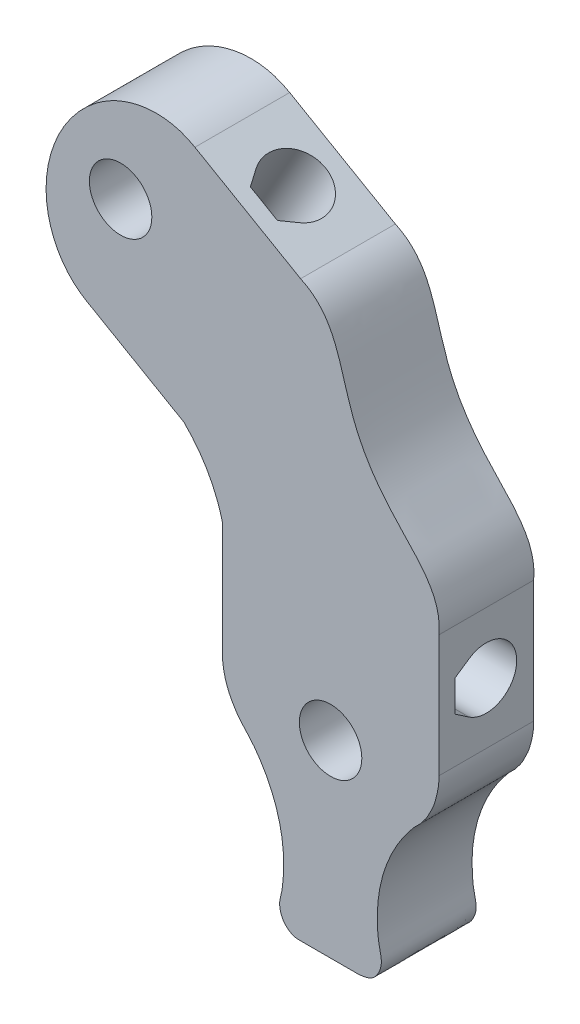
from build123d import *

# Parameters (mm, degrees)
MODEL_R               = 4.350000706
MODEL_R_2             = 4.349999799
MAIN_BODY_DEPTH       = 13.2
SIDE_UP_GRAPHIC_DEPTH = 1
HOLE_1_REACH          = 105.138
HOLE_2_REACH          = 92.65
FEET_START            = -13.2
FEET_DEPTH            = 13.2
FEET_2_DEPTH          = 13.2


with BuildPart() as part:
    # Model → Main body (new body)
    with BuildSketch(Plane.XY):
        with BuildLine():
            Line((-32.385278451, 85.015032789), (-17.6641047, 76.515992185))
            add(Edge.make_bspline(
                [(-17.6641047, 76.515992185), (-13.888722486, 74.796310284), (-12.180872386, 69.346040832), (-10.138677855, 62.322648799), (-7.341971962, 57.370319929), (-2.311165044, 51.709551581), (2.051636145, 47.586423037), (1.587639106, 43.172213575)],
                knots=[0, 0, 0, 0, 0.279425433, 0.41981198, 0.560237256, 0.707310001, 1, 1, 1, 1], degree=3))
            Line((1.587639106, 43.172213575), (1.587638631, 26.172213575))
            add(Edge.make_bspline(
                [(1.587638631, 26.172213575), (1.626935513, 22.433749487), (-1.504300665, 17.452795295), (-8.065829548, 14.211603151), (-13.487361838, 13.402379484), (-18.908893689, 14.211603727), (-25.470424367, 17.452793212), (-28.601657646, 22.43375075), (-28.56236242, 26.172213575)],
                knots=[0, 0, 0, 0, 0.249525848, 0.374711548, 0.499999996, 0.625288445, 0.750474147, 1, 1, 1, 1], degree=3))
            Line((-28.56236242, 26.172213575), (-28.56236242, 41.723666211))
            add(Edge.make_bspline(
                [(-33.914159524, 51.083510419), (-29.942183369, 47.173551609), (-28.56236242, 41.723666211)],
                knots=[0, 0, 0, 1, 1, 1], degree=2))
            Line((-33.914159524, 51.083510419), (-47.460258007, 58.904368421))
            add(Edge.make_bspline(
                [(-32.385278451, 85.015032789), (-35.600190369, 86.916553219), (-41.474036655, 86.698356276), (-47.559386008, 82.644557032), (-50.972092804, 78.360730829), (-52.985254476, 73.268128205), (-53.475705817, 65.95976879), (-50.710025567, 60.754293561), (-47.460258007, 58.904368421)],
                knots=[0, 0, 0, 0, 0.249337779, 0.374428166, 0.499621296, 0.624814359, 0.749906039, 1, 1, 1, 1], degree=3))
        make_face()
        with Locations((-13.487362418, 22.922213336)):
            Circle(MODEL_R, mode=Mode.SUBTRACT)
        with Locations((-42.737362401, 73.584699743)):
            Circle(MODEL_R_2, mode=Mode.SUBTRACT)
    extrude(amount=MAIN_BODY_DEPTH)

    # Model<4> → Side up graphic (cut)
    with BuildSketch(Plane.XY):
        Polygon((-12.838506986, 49.041740594), (-15.538506025, 49.04174176), (-15.538506908, 58.441741757), (-18.138507369, 58.441742904), (-14.138506535, 63.841741707), (-10.238506525, 58.441741095), (-12.838506986, 58.441742242), align=None)
        Polygon((-21.338505039, 58.441741118), (-21.338505039, 49.04173947), (-24.138505889, 49.041742563), (-24.138507726, 58.441740908), (-26.638506376, 58.441740128), (-22.63850624, 63.841741536), (-18.738507881, 58.441741879), align=None)
        Polygon((-26.238505906, 48.541742051), (-10.538506028, 48.54174036), (-10.538507195, 45.841741392), (-26.238507072, 45.841743083), align=None)
    extrude(amount=SIDE_UP_GRAPHIC_DEPTH, mode=Mode.SUBTRACT)

    # Schizzo3 → Hole 1 (cut, up to next)
    with BuildSketch(Plane(origin=(1.587637901, -4.4e-08, 0), x_dir=(0, 0, -1), z_dir=(0.9999999999999997, -2.789602577989315e-08, 0)), mode=Mode.PRIVATE) as hole_1_sk1:
        with BuildLine():
            Line((-10.95, 32.497213619), (-10.95, 36.847213619))
            Line((-10.95, 36.847213619), (-8.99780105, 38.181209219))
            ThreePointArc((-8.99780105, 38.181209219), (-2.35, 34.672213619), (-8.99780105, 31.163218019))
            Line((-8.99780105, 31.163218019), (-10.95, 32.497213619))
        make_face()
    hole_1_tool1 = extrude(hole_1_sk1.sketch, amount=-HOLE_1_REACH, mode=Mode.PRIVATE) & part.part
    add(hole_1_tool1.solids().sort_by_distance((1.587639, 34.672214, 6.73262))[0], mode=Mode.SUBTRACT)

    # Schizzo4 → Hole 2 (cut, up to next)
    with BuildSketch(Plane(origin=(28.716097743, 49.739103981, 0), x_dir=(0.8660313397108585, -0.499989718532907, 0), z_dir=(0.49998971853290697, 0.8660313397108584, 0)), mode=Mode.PRIVATE) as hole_2_sk1:
        with BuildLine():
            Line((-64.229093026, -10.95), (-59.879093026, -10.95))
            Line((-59.879093026, -10.95), (-58.545097426, -8.99780105))
            ThreePointArc((-58.545097426, -8.99780105), (-62.054093026, -2.35), (-65.563088627, -8.99780105))
            Line((-65.563088627, -8.99780105), (-64.229093026, -10.95))
        make_face()
    hole_2_tool1 = extrude(hole_2_sk1.sketch, amount=-HOLE_2_REACH, mode=Mode.PRIVATE) & part.part
    add(hole_2_tool1.solids().sort_by_distance((-25.024692, 80.765512, 6.73262))[0], mode=Mode.SUBTRACT)

    # Feet: read off the stored shape, not the designer's step
    # Feet outline → Feet (cut)
    with BuildSketch(Plane(origin=(0, 0, 0), x_dir=(-1, 0, 0), z_dir=(0, 0, -1)).offset(FEET_START)):
        with BuildLine():
            add(Edge.make_bspline(
                [(1.617445379, 18.475244195), (1.672241669, 18.422198484), (1.785443968, 18.310894344), (1.887324487, 18.202102285), (1.937328657, 18.146571293)],
                knots=[0.404989306, 0.404989306, 0.404989306, 0.404989306, 0.41039569, 0.416114241, 0.416114241, 0.416114241, 0.416114241], degree=3))
            add(Edge.make_bspline(
                [(1.617445379, 18.475244195), (1.722186479, 18.363918972), (1.828847726, 18.254343492), (1.937328657, 18.146571293)],
                knots=[0.196373675, 0.196373675, 0.196373675, 0.196373675, 0.206915239, 0.206915239, 0.206915239, 0.206915239], degree=3))
        make_face()
    extrude(amount=FEET_DEPTH, mode=Mode.SUBTRACT)

    # Feet 2 outline → Feet 2 (add)
    with BuildSketch(Plane(origin=(0, 0, 0), x_dir=(-1, 0, 0), z_dir=(0, 0, -1)).offset(FEET_START)):
        with BuildLine():
            add(Edge.make_bspline(
                [(-1.587638631, 26.172213575), (-1.618564778, 23.230089788), (-0.333725787, 20.549067776), (1.617445379, 18.475244195)],
                knots=[0, 0, 0, 0, 0.196373675, 0.196373675, 0.196373675, 0.196373675], degree=3))
            add(Edge.make_bspline(
                [(-1.587638631, 26.172213575), (-1.645799355, 25.352500299), (-1.370238761, 23.819193134), (-0.946380651, 22.322919054), (-0.335935677, 21.089168209), (0.039703043, 20.293595206), (0.786411785, 19.368229132), (0.91004105, 19.147407329), (1.546377013, 18.544042136), (1.617445379, 18.475244195)],
                knots=[0, 0, 0, 0, 0.121722264, 0.21246548, 0.234914634, 0.323764652, 0.341882744, 0.397977466, 0.404989306, 0.404989306, 0.404989306, 0.404989306], degree=3))
        make_face()
        with BuildLine():
            add(Edge.make_bspline(
                [(1.937328657, 18.146571293), (2.375825142, 17.710939612), (4.219661314, 16.111491194), (8.065829548, 14.211603151), (13.487361838, 13.402379484), (18.908893689, 14.211603727), (25.470424367, 17.452793212), (28.601657646, 22.43375075), (28.56236242, 26.172213575)],
                knots=[0.206915239, 0.206915239, 0.206915239, 0.206915239, 0.249525848, 0.374711548, 0.499999996, 0.625288445, 0.750474147, 1, 1, 1, 1], degree=3))
            add(Edge.make_bspline(
                [(1.937328657, 18.146571293), (2.265520543, 17.782105276), (2.58140699, 17.296879402), (3.794212722, 15.716220402), (4.820081692, 13.956885051), (5.810743144, 11.622003526), (6.39838083, 9.71468034), (6.793742924, 7.757133834), (6.994917172, 5.769303348), (6.982786394, 3.77453563), (6.84327878, 1.950183425), (6.48868216, 0.611023112), (6.338003308, -0.718293148), (6.905671081, -2.22430068), (7.917465645, -3.162516612), (9.419577102, -3.364915886), (9.465600294, -3.358418073)],
                knots=[0.416114241, 0.416114241, 0.416114241, 0.416114241, 0.453646757, 0.468506229, 0.553584024, 0.600937777, 0.648267117, 0.695592694, 0.742926149, 0.790263012, 0.837596467, 0.872691441, 0.888628807, 0.932636917, 0.976655261, 1, 1, 1, 1], degree=3))
            Line((9.465600294, -3.358418073), (17.592429859, -3.358418073))
            add(Edge.make_bspline(
                [(17.592429859, -3.358418073), (17.94710254, -3.361430129), (18.797097581, -3.339559885), (20.198227234, -2.290802404), (20.635216776, -0.823269702), (20.559713647, 0.184341362), (20.257398386, 1.191800118), (20.093724678, 2.681192511), (19.973919557, 4.670898735), (20.07803062, 6.666873348), (20.375555805, 8.641186349), (20.868893223, 10.57675976), (21.550372192, 12.453727407), (22.416941828, 14.253829078), (23.464728705, 15.951593879), (24.501456748, 17.375225201), (25.619319286, 18.495142101), (26.680160389, 19.804854398), (27.66821034, 21.497688321), (28.40075896, 23.671611828), (28.573115245, 25.178668256), (28.56236242, 26.172213575)],
                knots=[0, 0, 0, 0, 0.027659547, 0.083336738, 0.139000984, 0.159159574, 0.173630483, 0.233516851, 0.293375319, 0.353233787, 0.413120141, 0.47298465, 0.532856344, 0.592727518, 0.652578769, 0.712466068, 0.750774856, 0.79493166, 0.863998409, 0.926146295, 1, 1, 1, 1], degree=3))
        make_face()
    extrude(amount=FEET_2_DEPTH)


solid = part.part
